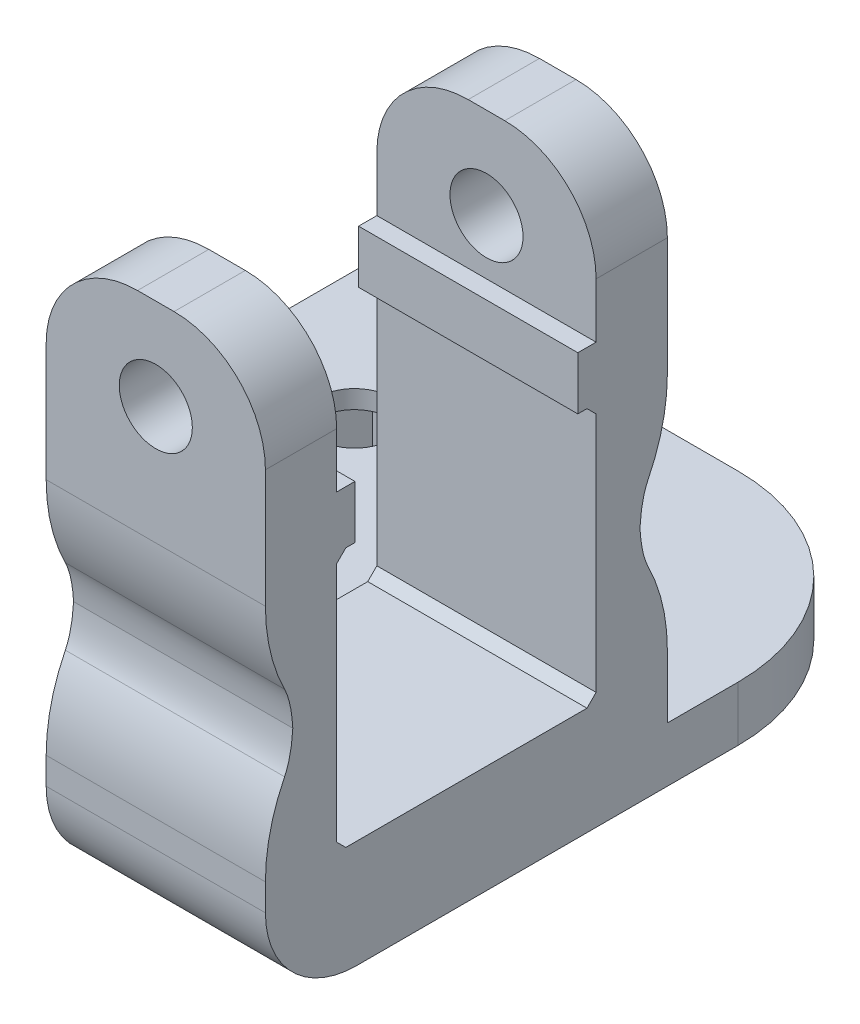
from build123d import *

# Parameters (mm, degrees)
ESQUISSE1_W                   = 30
ESQUISSE1_H                   = 40
BOSS_EXTRU_1_DEPTH            = 3
ESQUISSE8_W                   = 17
ESQUISSE8_H                   = 3.5
BOSS_EXTRU_2_DEPTH            = 20
ESQUISSE11_W                  = 3.5
ESQUISSE11_H                  = 20
ENL_V_MAT_EXTRU_9_DEPTH       = 5
ESQUISSE19_W                  = 12
ESQUISSE19_H                  = 20
BOSS_EXTRU_6_DEPTH            = 16.5
ESQUISSE20_W                  = 14.2
ESQUISSE20_H                  = 14.2
ENL_V_MAT_EXTRU_11_DEPTH      = 50.527769988
ESQUISSE29_W                  = 12
ESQUISSE29_H                  = 3
BOSS_EXTRU_9_DEPTH            = 17
ESQUISSE30_W                  = 12
ESQUISSE30_H                  = 23
BOSS_EXTRU_10_DEPTH           = 1
ESQUISSE31_W                  = 12
ESQUISSE31_H                  = 20
BOSS_EXTRU_11_DEPTH           = 1
ESQUISSE32_W                  = 12.2
ESQUISSE32_H                  = 2.9
ENL_V_MAT_EXTRU_12_DEPTH      = 50.527769988
ESQUISSE33_W                  = 12
ESQUISSE33_H                  = 3.9
BOSS_EXTRU_12_DEPTH           = 8
CONG_6_R                      = 5
ENL_V_MAT_EXTRU_14_DEPTH      = 53.417083332
ENL_V_MAT_EXTRU_14_DEPTH_BACK = 53.417083332
ESQUISSE36_R                  = 2
CHANFREIN1_SIZE               = 0.5
CONG_7_R                      = 5
ENL_V_MAT_EXTRU_15_DEPTH      = 54.712196008
CONG_8_R                      = 10
CONG_9_R                      = 10
ESQUISSE39_W                  = 30
ESQUISSE39_H                  = 3
BOSS_EXTRU_13_DEPTH           = 2
ESQUISSE40_W                  = 18
ESQUISSE40_H                  = 3
BOSS_EXTRU_14_DEPTH           = 2
ESQUISSE38_R                  = 2
ENL_V_MAT_EXTRU_16_DEPTH      = 61.207973065
ESQUISSE41_W                  = 14
ESQUISSE41_H                  = 16
ESQUISSE41_W_2                = 10
ESQUISSE41_H_2                = 12
BOSS_EXTRU_15_DEPTH           = 9
ESQUISSE42_W                  = 10
ESQUISSE42_H                  = 12
ENL_V_MAT_EXTRU_17_DEPTH      = 2
ESQUISSE43_W                  = 30
ESQUISSE43_H                  = 14
ENL_V_MAT_EXTRU_19_DEPTH      = 3
CONG_10_R                     = 10
ESQUISSE44_W                  = 6
ESQUISSE44_H                  = 16
BOSS_EXTRU_16_DEPTH           = 9
CHANFREIN2_SIZE               = 7
CONG_11_R                     = 10
ESQUISSE46_W                  = 10.2
ESQUISSE46_H                  = 12.2
ENL_V_MAT_EXTRU_20_DEPTH      = 11


with BuildPart() as part:
    # Esquisse1 → Boss.-Extru.1 (new body)
    with BuildSketch(Plane(origin=(0, 0, 0), x_dir=(1, 0, 0), z_dir=(0, 1, 0))):
        with Locations((15, 20)):
            Rectangle(ESQUISSE1_W, ESQUISSE1_H)
    extrude(amount=BOSS_EXTRU_1_DEPTH)

    # Esquisse8 → Boss.-Extru.2 (add)
    with BuildSketch(Plane(origin=(0, 3, 0), x_dir=(1, 0, 0), z_dir=(0, 1, 0))):
        with Locations((21.5, 11.375)):
            Rectangle(ESQUISSE8_W, ESQUISSE8_H)
    extrude(amount=BOSS_EXTRU_2_DEPTH)

    # Esquisse11 → Enlèv. mat.-Extru.9 (cut)
    with BuildSketch(Plane.ZY.offset(-13)):
        with Locations((-11.375, 13)):
            Rectangle(ESQUISSE11_W, ESQUISSE11_H)
    extrude(amount=-ENL_V_MAT_EXTRU_9_DEPTH, mode=Mode.SUBTRACT)

    # Esquisse19 → Boss.-Extru.6 (add)
    with BuildSketch(Plane.XY.offset(-9.625)):
        with Locations((24, 13)):
            Rectangle(ESQUISSE19_W, ESQUISSE19_H)
    extrude(amount=BOSS_EXTRU_6_DEPTH)

    # Esquisse20 → Enlèv. mat.-Extru.11 (cut, through all)
    with BuildSketch(Plane.ZY.offset(-18)):
        with Locations((-3.125, 13)):
            Rectangle(ESQUISSE20_W, ESQUISSE20_H)
    extrude(amount=-ENL_V_MAT_EXTRU_11_DEPTH, mode=Mode.SUBTRACT)

    # Esquisse29 → Boss.-Extru.9 (add)
    with BuildSketch(Plane.XY.offset(6.875)):
        with Locations((24, 1.5)):
            Rectangle(ESQUISSE29_W, ESQUISSE29_H)
    extrude(amount=-BOSS_EXTRU_9_DEPTH)

    # Esquisse30 → Boss.-Extru.10 (add)
    with BuildSketch(Plane.XY.offset(6.875)):
        with Locations((24, 11.5)):
            Rectangle(ESQUISSE30_W, ESQUISSE30_H)
    extrude(amount=BOSS_EXTRU_10_DEPTH)

    # Esquisse31 → Boss.-Extru.11 (add)
    with BuildSketch(Plane(origin=(0, 0, -13.125), x_dir=(-1, 0, 0), z_dir=(0, 0, -1))):
        with Locations((-24, 13)):
            Rectangle(ESQUISSE31_W, ESQUISSE31_H)
    extrude(amount=BOSS_EXTRU_11_DEPTH)

    # Esquisse32 → Enlèv. mat.-Extru.12 (cut, through all)
    with BuildSketch(Plane.ZY.offset(-18)):
        with Locations((-3.125, 21.55)):
            Rectangle(ESQUISSE32_W, ESQUISSE32_H)
    extrude(amount=-ENL_V_MAT_EXTRU_12_DEPTH, mode=Mode.SUBTRACT)

    # Esquisse33 → Boss.-Extru.12 (add)
    with BuildSketch(Plane(origin=(0, 23, 0), x_dir=(1, 0, 0), z_dir=(0, 1, 0))):
        with Locations((24, 12.175)):
            Rectangle(ESQUISSE33_W, ESQUISSE33_H)
        with Locations((24, -5.925)):
            Rectangle(ESQUISSE33_W, ESQUISSE33_H)
    extrude(amount=BOSS_EXTRU_12_DEPTH)

    # Congé6
    cong_6_edges = [part.edges().sort_by_distance(p)[0] for p in [
        (18, 31, -12.175),
        (30, 31, -12.175),
        (18, 31, 5.925),
        (30, 31, 5.925),
    ]]
    fillet(cong_6_edges, radius=CONG_6_R)

    # Esquisse36 → Enlèv. mat.-Extru.14 (cut, two sides: drawn at the far end of the back side and taken through both)
    with BuildSketch(Plane.XY.offset(-10.225).offset(-ENL_V_MAT_EXTRU_14_DEPTH_BACK)):
        with Locations((24, 26)):
            Circle(ESQUISSE36_R)
    extrude(amount=ENL_V_MAT_EXTRU_14_DEPTH + ENL_V_MAT_EXTRU_14_DEPTH_BACK, mode=Mode.SUBTRACT)

    # Chanfrein1
    chanfrein1_edges = [part.edges().sort_by_distance(p)[0] for p in [
        (24, 5.9, -10.225),
        (24, 20.1, -10.225),
        (24, 20.1, 3.975),
        (24, 5.9, 3.975),
    ]]
    chamfer(chanfrein1_edges, length=CHANFREIN1_SIZE)

    # Congé7
    cong_7_edges = [part.edges().sort_by_distance(p)[0] for p in [
        (24, 0, 7.875),
    ]]
    fillet(cong_7_edges, radius=CONG_7_R)

    # Esquisse37 → Enlèv. mat.-Extru.15 (cut, through all)
    with BuildSketch(Plane.ZY.offset(-18)):
        with BuildLine():
            Line((-14.125, 16), (-14.125, 10))
            add(Edge.make_bspline(
                [(-14.125, 10), (-12.780635922, 10.344634173), (-12.625, 13)],
                knots=[0, 0, 0, 1, 1, 1], degree=2))
            add(Edge.make_bspline(
                [(-14.125, 16), (-12.780635922, 15.655365827), (-12.625, 13)],
                knots=[0, 0, 0, 1, 1, 1], degree=2))
        make_face()
        with BuildLine():
            Line((7.875, 16), (7.875, 10))
            add(Edge.make_bspline(
                [(7.875, 10), (6.530635922, 10.344634173), (6.375, 13)],
                knots=[0, 0, 0, 1, 1, 1], degree=2))
            add(Edge.make_bspline(
                [(7.875, 16), (6.530635922, 15.655365827), (6.375, 13)],
                knots=[0, 0, 0, 1, 1, 1], degree=2))
        make_face()
    extrude(amount=-ENL_V_MAT_EXTRU_15_DEPTH, mode=Mode.SUBTRACT)

    # Congé8
    cong_8_edges = [part.edges().sort_by_distance(p)[0] for p in [
        (24, 10, 7.875),
        (24, 16, 7.875),
    ]]
    fillet(cong_8_edges, radius=CONG_8_R)

    # Congé9
    cong_9_edges = [part.edges().sort_by_distance(p)[0] for p in [
        (24, 16, -14.125),
        (24, 10, -14.125),
    ]]
    fillet(cong_9_edges, radius=CONG_9_R)

    # Esquisse39 → Boss.-Extru.13 (add)
    with BuildSketch(Plane(origin=(0, 0, -40), x_dir=(-1, 0, 0), z_dir=(0, 0, -1))):
        with Locations((-15, 1.5)):
            Rectangle(ESQUISSE39_W, ESQUISSE39_H)
    extrude(amount=BOSS_EXTRU_13_DEPTH)

    # Esquisse40 → Boss.-Extru.14 (add)
    with BuildSketch(Plane.XY):
        with Locations((9, 1.5)):
            Rectangle(ESQUISSE40_W, ESQUISSE40_H)
    extrude(amount=BOSS_EXTRU_14_DEPTH)

    # Esquisse38 → Enlèv. mat.-Extru.16 (cut, through all)
    with BuildSketch(Plane.XZ):
        with Locations(Location((7, -20, 0), (0, 0, 270))):
            Circle(ESQUISSE38_R)
    extrude(amount=-ENL_V_MAT_EXTRU_16_DEPTH, mode=Mode.SUBTRACT)

    # Esquisse41 → Boss.-Extru.15 (add)
    with BuildSketch(Plane.XZ):
        with Locations((7, -20)):
            Rectangle(ESQUISSE41_W, ESQUISSE41_H)
        with Locations((7, -20)):
            Rectangle(ESQUISSE41_W_2, ESQUISSE41_H_2, mode=Mode.SUBTRACT)
    extrude(amount=BOSS_EXTRU_15_DEPTH)

    # Esquisse42 → Enlèv. mat.-Extru.17 (cut)
    with BuildSketch(Plane.XZ):
        with Locations((7, -20)):
            Rectangle(ESQUISSE42_W, ESQUISSE42_H)
    extrude(amount=-ENL_V_MAT_EXTRU_17_DEPTH, mode=Mode.SUBTRACT)

    # Esquisse43 → Enlèv. mat.-Extru.19 (cut)
    with BuildSketch(Plane.XZ):
        with Locations((15, -35)):
            Rectangle(ESQUISSE43_W, ESQUISSE43_H)
        Polygon((0, -12), (0, 2), (15, 2), align=None)
    extrude(amount=-ENL_V_MAT_EXTRU_19_DEPTH, mode=Mode.SUBTRACT)

    # Congé10
    cong_10_edges = [part.edges().sort_by_distance(p)[0] for p in [
        (30, 1.5, -28),
    ]]
    fillet(cong_10_edges, radius=CONG_10_R)

    # Esquisse44 → Boss.-Extru.16 (add)
    with BuildSketch(Plane.XZ):
        with Locations((17, -20)):
            Rectangle(ESQUISSE44_W, ESQUISSE44_H)
    extrude(amount=BOSS_EXTRU_16_DEPTH)

    # Chanfrein2
    chanfrein2_edges = [part.edges().sort_by_distance(p)[0] for p in [
        (20, -9, -20),
    ]]
    chamfer(chanfrein2_edges, length=CHANFREIN2_SIZE)

    # Congé11
    # the kernel refuses this fillet: 10 mm, written as the material it takes off along each edge
    with BuildSketch(Plane(origin=(20, -2, -2.718486848), x_dir=(-0.7071067811865474, -0.7071067811865477, 0), z_dir=(0, 0, -1))) as cong_11_piece_1:
        with BuildLine():
            CenterArc((3.712605261, 10), CONG_11_R, 239.157365729, 30.842634271)
            Line((-1.414213562, 1.414213562), (-1.516749939, 1.242497834))
            ThreePointArc((-1.516749939, 1.242497834), (-0.848528137, 0.565685425), (-0.141421356, -0.141421356))
            Line((-0.141421356, -0.141421356), (0, -0.2))
            Line((0, -0.2), (3.712605261, -0.2))
            Line((3.712605261, -0.2), (3.712605261, 0))
        make_face()
    extrude(amount=34.563026305, mode=Mode.SUBTRACT)

    # Esquisse46 → Enlèv. mat.-Extru.20 (cut)
    with BuildSketch(Plane.XZ.offset(9)):
        with Locations((7, -20)):
            Rectangle(ESQUISSE46_W, ESQUISSE46_H)
    extrude(amount=-ENL_V_MAT_EXTRU_20_DEPTH, mode=Mode.SUBTRACT)


solid = part.part
